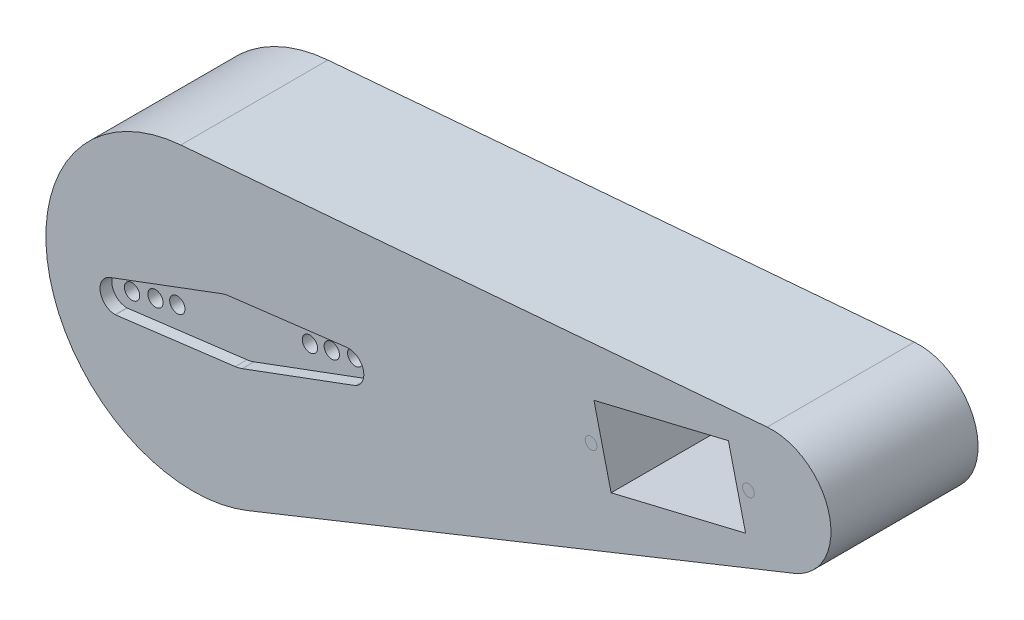
from build123d import *

# Parameters (mm, degrees)
EXTRUDE_3_DEPTH          = 25
CUT_EXTRUDE_6_DEPTH      = 25
SKETCH_9_R               = 1
CUT_EXTRUDE_11_DEPTH     = 0.001
CUT_EXTRUDE_12_DEPTH     = 4
CUT_EXTRUDE_17_DEPTH     = 2
CUT_EXTRUDE_START        = 2
CUT_EXTRUDE_18_DEPTH     = 2
CUT_EXTRUDE_START_2      = 20
CUT_EXTRUDE_19_OUTLINE_R = 1.3
CUT_EXTRUDE_19_DEPTH     = 3
SKETCH_4_20_R            = 1.3
CUT_EXTRUDE_20_DEPTH     = 5


# Read off the part's stored shape, not the designer's step: 切除-拉伸19
with BuildPart() as part:
    # 草图7 → 凸台-拉伸3 (new body)
    with BuildSketch(Plane.XY):
        with BuildLine():
            Line((99.654203795, 8.309011134), (0, 0))
            ThreePointArc((0, 0), (-22.25252281, -30.663509172), (11.372685429, -48.121199083))
            Line((11.372685429, -48.121199083), (104.203277967, -10.939468499))
            ThreePointArc((104.203277967, -10.939468499), (110.217015146, 0.643574044), (99.654203795, 8.309011134))
        make_face()
    extrude(amount=EXTRUDE_3_DEPTH)

    # 草图3 → 切除-拉伸6 (cut)
    with BuildSketch(Plane.XY):
        Polygon((95.977186606, -9.138607998), (73.126313538, -14.623824499), (70.208645187, -2.469104782), (93.059518254, 3.016111719), align=None)
    extrude(amount=CUT_EXTRUDE_6_DEPTH, mode=Mode.SUBTRACT)

    # 草图9 → 切除-拉伸11 (cut)
    with BuildSketch(Plane.XY.offset(25)):
        with Locations((69.722724208, -9.013291577)):
            Circle(SKETCH_9_R)
        with Locations(Location((96.463107585, -2.594421203, 0), (0, 0, 180))):
            Circle(SKETCH_9_R)
    extrude(amount=-CUT_EXTRUDE_11_DEPTH, mode=Mode.SUBTRACT)

    # 草图3<11> → 切除-拉伸12 (cut)
    with BuildSketch(Plane.XY):
        Polygon((72.842644051, -13.442085282), (67.980756164, -14.609152622), (65.701162058, -5.112587525), (70.563049944, -3.945520185), align=None)
    extrude(amount=CUT_EXTRUDE_12_DEPTH, mode=Mode.SUBTRACT)

    # Sketch 3D_5 → 切除-拉伸17 (cut)
    with BuildSketch(Plane(origin=(10.444215818, -27.693919668, 25), x_dir=(-0.9953297932940416, 0.09653290931718772, 0), z_dir=(0, 0, -1))):
        with BuildLine():
            Line((0, 0), (-18.453401997, 8.947839585))
            ThreePointArc((-18.453401997, 8.947839585), (-18.48417706, 8.964108788), (-18.513745535, 8.982479872))
            ThreePointArc((-18.513745535, 8.982479872), (-19.45567303, 12.165265617), (-16.502248474, 13.680071182))
            Line((-16.502248474, 13.680071182), (3.235389304, 9.299601756))
            ThreePointArc((3.235389304, 9.299601756), (3.842109592, 9.12676054), (4.424199035, 8.883541558))
            Line((4.424199035, 8.883541558), (22.585849479, 0))
            ThreePointArc((22.585849479, 0), (23.950111663, -3.025911631), (21.229027313, -4.926714742))
            ThreePointArc((21.229027313, -4.926714742), (21.194456039, -4.922638166), (21.160252198, -4.916166022))
            Line((21.160252198, -4.916166022), (1.154440034, -0.404031474))
            ThreePointArc((1.154440034, -0.404031474), (0.56560873, -0.235192692), (0, 0))
        make_face()
    extrude(amount=CUT_EXTRUDE_17_DEPTH, mode=Mode.SUBTRACT)

    # 草图4<19> → 切除-拉伸18 (cut)
    with BuildSketch(Plane.XY.offset(CUT_EXTRUDE_START)):
        with BuildLine():
            Line((29.675197601, -20.569228925), (10.444215818, -27.693919668))
            ThreePointArc((10.444215818, -27.693919668), (9.858544762, -27.873414105), (9.256164924, -27.984622777))
            Line((9.256164924, -27.984622777), (-11.091785437, -30.544465472))
            ThreePointArc((-11.091785437, -30.544465472), (-11.126454314, -30.547605594), (-11.161257657, -30.548325866))
            ThreePointArc((-11.161257657, -30.548325866), (-13.686143926, -28.393725709), (-12.036153076, -25.513641909))
            Line((-12.036153076, -25.513641909), (6.898232818, -18.424785281))
            ThreePointArc((6.898232818, -18.424785281), (7.50108242, -18.23889297), (8.121654063, -18.125427433))
            Line((8.121654063, -18.125427433), (28.189972451, -15.670747301))
            ThreePointArc((28.189972451, -15.670747301), (30.983375316, -17.463581076), (29.738603249, -20.540575553))
            ThreePointArc((29.738603249, -20.540575553), (29.707399451, -20.556006509), (29.675197601, -20.569228925))
        make_face()
    extrude(amount=-CUT_EXTRUDE_18_DEPTH, mode=Mode.SUBTRACT)

    # 切除-拉伸19 outline → 切除-拉伸19 (cut)
    with BuildSketch(Plane.XY.offset(CUT_EXTRUDE_START_2)):
        with Locations((27.642515471, -18.415074729)):
            Circle(CUT_EXTRUDE_19_OUTLINE_R)
        with Locations((23.660004397, -19.389551795)):
            Circle(CUT_EXTRUDE_19_OUTLINE_R)
        with Locations((19.947149108, -20.298047028)):
            Circle(CUT_EXTRUDE_19_OUTLINE_R)
        with Locations((-2.588035502, -25.812161156)):
            Circle(CUT_EXTRUDE_19_OUTLINE_R)
        with Locations((-6.300890791, -26.72065639)):
            Circle(CUT_EXTRUDE_19_OUTLINE_R)
        with Locations((-10.283401864, -27.695133455)):
            Circle(CUT_EXTRUDE_19_OUTLINE_R)
    extrude(amount=CUT_EXTRUDE_19_DEPTH, mode=Mode.SUBTRACT)

    # 草图4<20> → 切除-拉伸20 (cut)
    with BuildSketch(Plane.XY):
        with Locations(Location((-2.588035502, -25.812161156, 0), (0, 0, 180))):
            Circle(SKETCH_4_20_R)
        with Locations(Location((27.642515471, -18.415074729, 0), (0, 0, 180))):
            Circle(SKETCH_4_20_R)
        with Locations(Location((23.660004397, -19.389551795, 0), (0, 0, 180))):
            Circle(SKETCH_4_20_R)
        with Locations(Location((19.947149108, -20.298047028, 0), (0, 0, 180))):
            Circle(SKETCH_4_20_R)
        with Locations(Location((-6.300890791, -26.72065639, 0), (0, 0, 180))):
            Circle(SKETCH_4_20_R)
        with Locations(Location((-10.283401864, -27.695133455, 0), (0, 0, 180))):
            Circle(SKETCH_4_20_R)
    extrude(amount=CUT_EXTRUDE_20_DEPTH, mode=Mode.SUBTRACT)


solid = part.part
